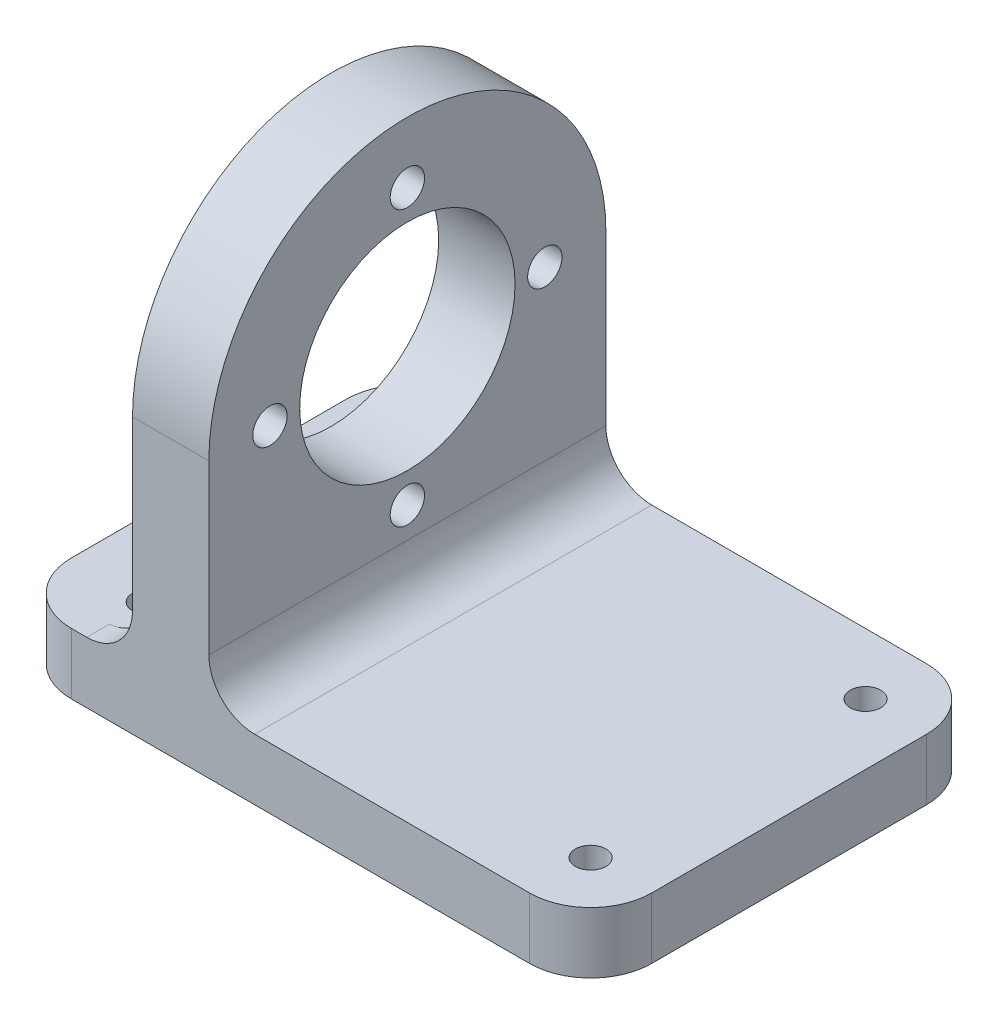
from build123d import *

# Parameters (mm, degrees)
SKETCH1_R                = 1.125
SKETCH1_R_2              = 7.05
BOSS_EXTRUDE1_DEPTH      = 5
BOSS_EXTRUDE2_DEPTH      = 8
BOSS_EXTRUDE2_DEPTH_BACK = 30
SKETCH2_W                = 26
SKETCH2_H                = 4
FILLET1_R                = 3
FILLET2_R                = 4
CUT_EXTRUDE1_DEPTH       = 43.402830094
CUT_EXTRUDE1_DEPTH_BACK  = 43.402830094
SKETCH3_R                = 1
CUT_EXTRUDE3_REACH       = 44.403
SKETCH4_R                = 2.5


with BuildPart() as part:
    # Sketch1 → Boss-Extrude1 (new body)
    with BuildSketch(Plane(origin=(0, 0, 0), x_dir=(0, 0, -1), z_dir=(1, 0, 0))):
        with BuildLine():
            Line((-13, 0), (-13, -18))
            Line((-13, -18), (13, -18))
            Line((13, -18), (13, 0))
            ThreePointArc((13, 0), (0, 13), (-13, 0))
        make_face()
        with Locations((0, 9)):
            Circle(SKETCH1_R, mode=Mode.SUBTRACT)
        with Locations((9, 0)):
            Circle(SKETCH1_R, mode=Mode.SUBTRACT)
        with Locations((0, -9)):
            Circle(SKETCH1_R, mode=Mode.SUBTRACT)
        with Locations((-9, 0)):
            Circle(SKETCH1_R, mode=Mode.SUBTRACT)
        Circle(SKETCH1_R_2, mode=Mode.SUBTRACT)
    extrude(amount=BOSS_EXTRUDE1_DEPTH)

    # Sketch2 → Boss-Extrude2 (add, two sides: drawn at the far end of the back side and taken through both)
    with BuildSketch(Plane.ZY.offset(-BOSS_EXTRUDE2_DEPTH_BACK)):
        with Locations((0, -16)):
            Rectangle(SKETCH2_W, SKETCH2_H)
    extrude(amount=BOSS_EXTRUDE2_DEPTH + BOSS_EXTRUDE2_DEPTH_BACK)

    # Fillet1
    fillet1_edges = [part.edges().sort_by_distance(p)[0] for p in [
        (5, -14, 0),
        (0, -14, 0),
    ]]
    fillet(fillet1_edges, radius=FILLET1_R)

    # Fillet2
    fillet2_edges = [part.edges().sort_by_distance(p)[0] for p in [
        (30, -16, -13),
        (30, -16, 13),
        (-8, -16, -13),
        (-8, -16, 13),
    ]]
    fillet(fillet2_edges, radius=FILLET2_R)

    # Sketch3 → Cut-Extrude1 (cut, two sides: drawn at the far end of the back side and taken through both)
    with BuildSketch(Plane(origin=(0, -14, 0), x_dir=(1, 0, 0), z_dir=(0, 1, 0)).offset(-CUT_EXTRUDE1_DEPTH_BACK)):
        with Locations((-3, -9)):
            Circle(SKETCH3_R)
        with Locations((-3, 9)):
            Circle(SKETCH3_R)
        with Locations((26, 9)):
            Circle(SKETCH3_R)
        with Locations((26, -9)):
            Circle(SKETCH3_R)
    extrude(amount=CUT_EXTRUDE1_DEPTH + CUT_EXTRUDE1_DEPTH_BACK, mode=Mode.SUBTRACT)

    # Sketch4 → Cut-Extrude3 (cut, up to next)
    with BuildSketch(Plane(origin=(0, -14, 0), x_dir=(1, 0, 0), z_dir=(0, 1, 0)), mode=Mode.PRIVATE) as cut_extrude3_sk1:
        with Locations((-3, 9)):
            Circle(SKETCH4_R)
    cut_extrude3_tool1 = extrude(cut_extrude3_sk1.sketch, amount=CUT_EXTRUDE3_REACH, mode=Mode.PRIVATE) & part.part
    # Sketch4 → Cut-Extrude3 (cut, up to next)
    with BuildSketch(Plane(origin=(0, -14, 0), x_dir=(1, 0, 0), z_dir=(0, 1, 0)), mode=Mode.PRIVATE) as cut_extrude3_sk2:
        with Locations((-3, -9)):
            Circle(SKETCH4_R)
    cut_extrude3_tool2 = extrude(cut_extrude3_sk2.sketch, amount=CUT_EXTRUDE3_REACH, mode=Mode.PRIVATE) & part.part
    add(cut_extrude3_tool1.solids().sort_by_distance((-3, -14, -9))[0], mode=Mode.SUBTRACT)
    add(cut_extrude3_tool2.solids().sort_by_distance((-3, -14, 9))[0], mode=Mode.SUBTRACT)


solid = part.part
